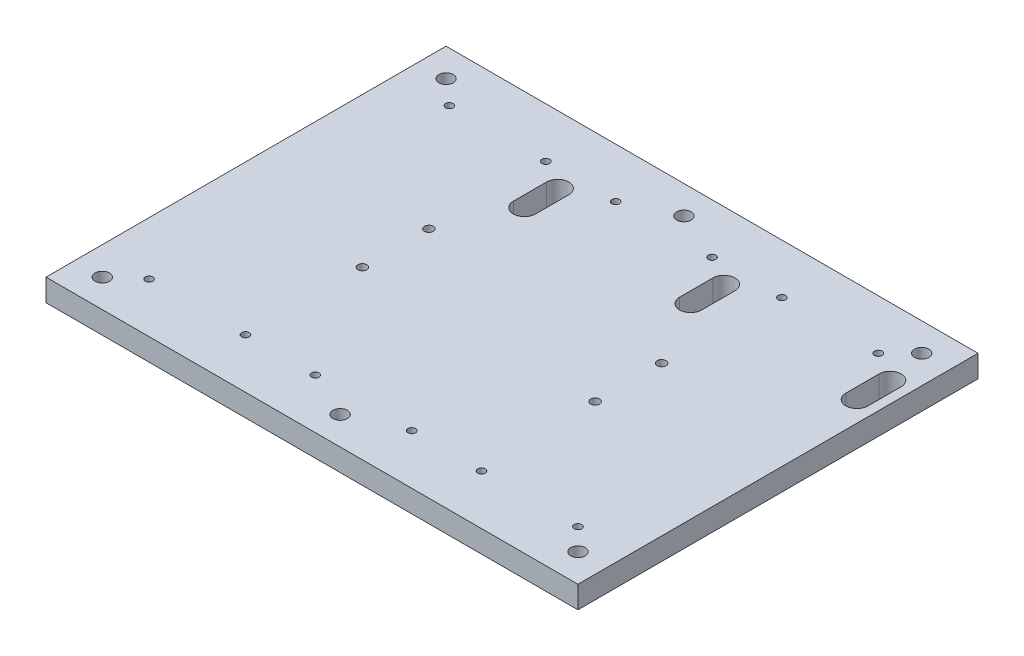
from build123d import *

# Parameters (mm, degrees)
SKETCH1_W           = 240
SKETCH1_H           = 180.5
BOSS_EXTRUDE1_DEPTH = 10
SKETCH1_5_R         = 1.7
CUT_EXTRUDE2_DEPTH  = 151.482764794
SKETCH2_W           = 120
SKETCH2_H           = 6
BOSS_EXTRUDE3_DEPTH = 30
SKETCH3_W           = 120
SKETCH3_H           = 9
BOSS_EXTRUDE4_DEPTH = 20
SKETCH4_R           = 2
CUT_EXTRUDE4_DEPTH  = 154.117805953
SKETCH7_R           = 3.25
CUT_EXTRUDE5_DEPTH  = 154.117805953
CUT_EXTRUDE6_DEPTH  = 156.386815721


with BuildPart() as part:
    # Sketch1 → Boss-Extrude1 (new body)
    with BuildSketch(Plane(origin=(0, 0, 0), x_dir=(1, 0, 0), z_dir=(0, 1, 0))):
        Rectangle(SKETCH1_W, SKETCH1_H)
    extrude(amount=-BOSS_EXTRUDE1_DEPTH)

    # Sketch1<5> → Cut-Extrude2 (cut, through all)
    with BuildSketch(Plane(origin=(0, 0, 0), x_dir=(1, 0, 0), z_dir=(0, 1, 0))):
        with Locations((-96, 67.75)):
            Circle(SKETCH1_5_R)
        with Locations((-96, -67.75)):
            Circle(SKETCH1_5_R)
        with Locations((-52.5, -67.75)):
            Circle(SKETCH1_5_R)
        with Locations((-52.5, 67.75)):
            Circle(SKETCH1_5_R)
        with Locations((-21, 67.75)):
            Circle(SKETCH1_5_R)
        with Locations((-21, -67.75)):
            Circle(SKETCH1_5_R)
        with Locations((22.5, -67.75)):
            Circle(SKETCH1_5_R)
        with Locations((22.5, 67.75)):
            Circle(SKETCH1_5_R)
        with Locations((54, 67.75)):
            Circle(SKETCH1_5_R)
        with Locations((54, -67.75)):
            Circle(SKETCH1_5_R)
        with Locations((97.5, -67.75)):
            Circle(SKETCH1_5_R)
        with Locations((97.5, 67.75)):
            Circle(SKETCH1_5_R)
    extrude(amount=-CUT_EXTRUDE2_DEPTH, mode=Mode.SUBTRACT)

    # Sketch2 → Boss-Extrude3 (add)
    with BuildSketch(Plane.XZ.offset(10)):
        Rectangle(SKETCH2_W, SKETCH2_H)
    extrude(amount=BOSS_EXTRUDE3_DEPTH)

    # Sketch3 → Boss-Extrude4 (add)
    with BuildSketch(Plane.XZ.offset(10)):
        Rectangle(SKETCH3_W, SKETCH3_H)
    extrude(amount=BOSS_EXTRUDE4_DEPTH)

    # Sketch4 → Cut-Extrude4 (cut, through all)
    with BuildSketch(Plane.XZ.offset(10)):
        with Locations((-52.5, 15)):
            Circle(SKETCH4_R)
        with Locations((52.5, 15)):
            Circle(SKETCH4_R)
        with Locations((52.5, -15)):
            Circle(SKETCH4_R)
        with Locations((-52.5, -15)):
            Circle(SKETCH4_R)
    extrude(amount=-CUT_EXTRUDE4_DEPTH, mode=Mode.SUBTRACT)

    # Sketch7 → Cut-Extrude5 (cut, through all)
    with BuildSketch(Plane.XZ.offset(10)):
        with Locations((-107.3, 77.55)):
            Circle(SKETCH7_R)
        with Locations((0, 77.55)):
            Circle(SKETCH7_R)
        with Locations((107.3, 77.55)):
            Circle(SKETCH7_R)
        with Locations((-107.3, -77.55)):
            Circle(SKETCH7_R)
        with Locations((0, -77.55)):
            Circle(SKETCH7_R)
        with Locations((107.3, -77.55)):
            Circle(SKETCH7_R)
    extrude(amount=-CUT_EXTRUDE5_DEPTH, mode=Mode.SUBTRACT)

    # Sketch9 → Cut-Extrude6 (cut, through all)
    with BuildSketch(Plane(origin=(0, 0, 0), x_dir=(1, 0, 0), z_dir=(0, 1, 0))):
        with BuildLine():
            Line((-34.25, 59.85), (-34.25, 44.85))
            ThreePointArc((-34.25, 44.85), (-39.25, 39.85), (-44.25, 44.85))
            Line((-44.25, 44.85), (-44.25, 59.85))
            ThreePointArc((-44.25, 59.85), (-39.25, 64.85), (-34.25, 59.85))
        make_face()
        with BuildLine():
            Line((40.75, 59.85), (40.75, 44.85))
            ThreePointArc((40.75, 44.85), (35.75, 39.85), (30.75, 44.85))
            Line((30.75, 44.85), (30.75, 59.85))
            ThreePointArc((30.75, 59.85), (35.75, 64.85), (40.75, 59.85))
        make_face()
        with BuildLine():
            Line((115.75, 59.85), (115.75, 44.85))
            ThreePointArc((115.75, 44.85), (110.75, 39.85), (105.75, 44.85))
            Line((105.75, 44.85), (105.75, 59.85))
            ThreePointArc((105.75, 59.85), (110.75, 64.85), (115.75, 59.85))
        make_face()
    extrude(amount=-CUT_EXTRUDE6_DEPTH, mode=Mode.SUBTRACT)


solid = part.part
